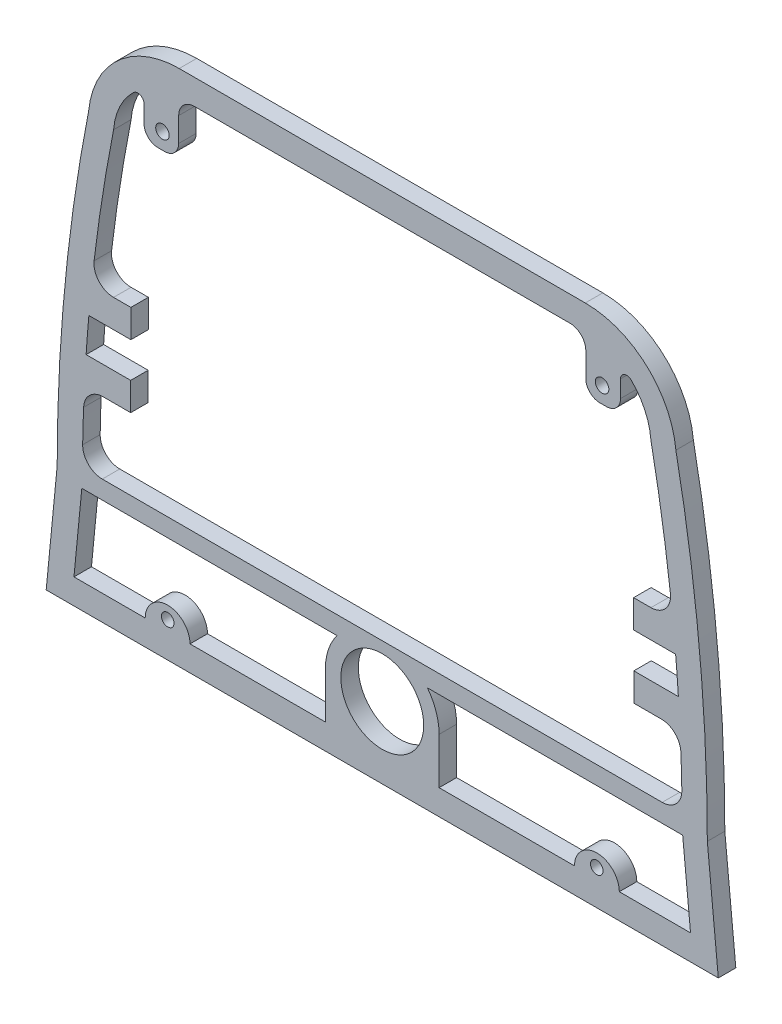
from build123d import *

# Parameters (mm, degrees)
SKETCH1_R           = 0.6096
SKETCH1_R_2         = 3.7592
SKETCH1_R_3         = 0.5715
BOSS_EXTRUDE1_DEPTH = 1.5875
FILLET1_R           = 1.778


with BuildPart() as part:
    # Sketch1 → Boss-Extrude1 (new body)
    with BuildSketch(Plane.XY):
        with BuildLine():
            Line((30.48, -22.225), (29.483473933, -11.9888))
            ThreePointArc((29.483473933, -11.9888), (28.768713075, 2.729791064), (26.631156966, 17.309868563))
            ThreePointArc((26.631156966, 17.309868563), (23.962166394, 22.62342539), (18.415, 24.765))
            Line((18.415, 24.765), (-18.415, 24.765))
            ThreePointArc((-18.415, 24.765), (-23.962166394, 22.62342539), (-26.631156966, 17.309868563))
            ThreePointArc((-26.631156966, 17.309868563), (-28.768713075, 2.729791064), (-29.483473933, -11.9888))
            Line((-29.483473933, -11.9888), (-30.48, -22.225))
            Line((-30.48, -22.225), (30.48, -22.225))
        make_face()
        with BuildLine():
            Line((-17.030074915, 22.479), (17.030074915, 22.479))
            ThreePointArc((17.030074915, 22.479), (18.043126102, 22.059380459), (18.462745643, 21.046329273))
            Line((18.462745643, 21.046329273), (18.462745643, 18.851715923))
            ThreePointArc((18.462745643, 18.851715923), (18.83472003, 17.953690311), (19.732745643, 17.581715923))
            Line((19.732745643, 17.581715923), (20.340525582, 17.581715923))
            ThreePointArc((20.340525582, 17.581715923), (21.238551194, 17.953690311), (21.610525582, 18.851715923))
            Line((21.610525582, 18.851715923), (21.610525582, 20.403695369))
            ThreePointArc((21.610525582, 20.403695369), (21.951294314, 20.918726173), (22.558568851, 20.806486725))
            ThreePointArc((22.558568851, 20.806486725), (23.811140787, 19.061592759), (24.364966869, 16.986293244))
            ThreePointArc((24.364966869, 16.986293244), (25.509758778, 10.420381416), (26.360995625, 3.81))
            Line((26.360995625, 3.81), (22.798827702, 3.81))
            Line((22.798827702, 3.81), (22.798827702, 1.27))
            Line((22.798827702, 1.27), (26.608827702, 1.27))
            ThreePointArc((26.608827702, 1.27), (26.742491756, -0.329529051), (26.858988411, -1.9304))
            Line((26.858988411, -1.9304), (22.817450332, -1.9304))
            Line((22.817450332, -1.9304), (22.817450332, -4.4704))
            Line((22.817450332, -4.4704), (27.008450332, -4.4704))
            ThreePointArc((27.008450332, -4.4704), (27.136580505, -7.720591329), (27.194024219, -10.9728))
            Line((27.194024219, -10.9728), (-27.194024219, -10.9728))
            ThreePointArc((-27.194024219, -10.9728), (-27.136580505, -7.720591329), (-27.008450332, -4.4704))
            Line((-27.008450332, -4.4704), (-22.817450332, -4.4704))
            Line((-22.817450332, -4.4704), (-22.817450332, -1.9304))
            Line((-22.817450332, -1.9304), (-26.858988411, -1.9304))
            ThreePointArc((-26.858988411, -1.9304), (-26.742491756, -0.329529051), (-26.608827702, 1.27))
            Line((-26.608827702, 1.27), (-22.798827702, 1.27))
            Line((-22.798827702, 1.27), (-22.798827702, 3.81))
            Line((-22.798827702, 3.81), (-26.360995625, 3.81))
            ThreePointArc((-26.360995625, 3.81), (-25.509758778, 10.420381416), (-24.364966869, 16.986293244))
            ThreePointArc((-24.364966869, 16.986293244), (-23.811140787, 19.061592759), (-22.558568851, 20.806486725))
            ThreePointArc((-22.558568851, 20.806486725), (-21.951294314, 20.918726173), (-21.610525582, 20.403695369))
            Line((-21.610525582, 20.403695369), (-21.610525582, 18.851715923))
            ThreePointArc((-21.610525582, 18.851715923), (-21.238551194, 17.953690311), (-20.340525582, 17.581715923))
            Line((-20.340525582, 17.581715923), (-19.732745643, 17.581715923))
            ThreePointArc((-19.732745643, 17.581715923), (-18.83472003, 17.953690311), (-18.462745643, 18.851715923))
            Line((-18.462745643, 18.851715923), (-18.462745643, 21.046329273))
            ThreePointArc((-18.462745643, 21.046329273), (-18.043126102, 22.059380459), (-17.030074915, 22.479))
        make_face(mode=Mode.SUBTRACT)
        with BuildLine():
            Line((-27.960643369, -19.939), (-27.248485782, -12.6238))
            Line((-27.248485782, -12.6238), (-4.101923061, -12.6238))
            ThreePointArc((-4.101923061, -12.6238), (-4.885526283, -14.099354685), (-5.1562, -15.748))
            Line((-5.1562, -15.748), (-5.1562, -19.939))
            Line((-5.1562, -19.939), (-17.436635613, -19.939))
            ThreePointArc((-17.436635613, -19.939), (-19.468635613, -17.907), (-21.500635613, -19.939))
            Line((-21.500635613, -19.939), (-27.960643369, -19.939))
        make_face(mode=Mode.SUBTRACT)
        with BuildLine():
            Line((17.436635613, -19.939), (5.1562, -19.939))
            Line((5.1562, -19.939), (5.1562, -15.748))
            ThreePointArc((5.1562, -15.748), (4.885526283, -14.099354685), (4.101923061, -12.6238))
            Line((4.101923061, -12.6238), (27.248485782, -12.6238))
            Line((27.248485782, -12.6238), (27.960643369, -19.939))
            Line((27.960643369, -19.939), (21.500635613, -19.939))
            ThreePointArc((21.500635613, -19.939), (19.468635613, -17.907), (17.436635613, -19.939))
        make_face(mode=Mode.SUBTRACT)
        with Locations((-19.939, 19.05)):
            Circle(SKETCH1_R, mode=Mode.SUBTRACT)
        with Locations((0, -15.748)):
            Circle(SKETCH1_R_2, mode=Mode.SUBTRACT)
        with Locations((-19.457528855, -19.05)):
            Circle(SKETCH1_R_3, mode=Mode.SUBTRACT)
        with Locations((19.457528855, -19.05)):
            Circle(SKETCH1_R_3, mode=Mode.SUBTRACT)
        with Locations((19.939, 19.05)):
            Circle(SKETCH1_R, mode=Mode.SUBTRACT)
    extrude(amount=BOSS_EXTRUDE1_DEPTH)

    # Fillet1
    fillet1_edges = [part.edges().sort_by_distance(p)[0] for p in [
        (26.360995625, 3.81, 0.79375),
        (27.194024219, -10.9728, 0.79375),
        (27.008450332, -4.4704, 0.79375),
        (-27.008450332, -4.4704, 0.79375),
        (-27.194024219, -10.9728, 0.79375),
        (-26.360995625, 3.81, 0.79375),
    ]]
    fillet(fillet1_edges, radius=FILLET1_R)


solid = part.part
